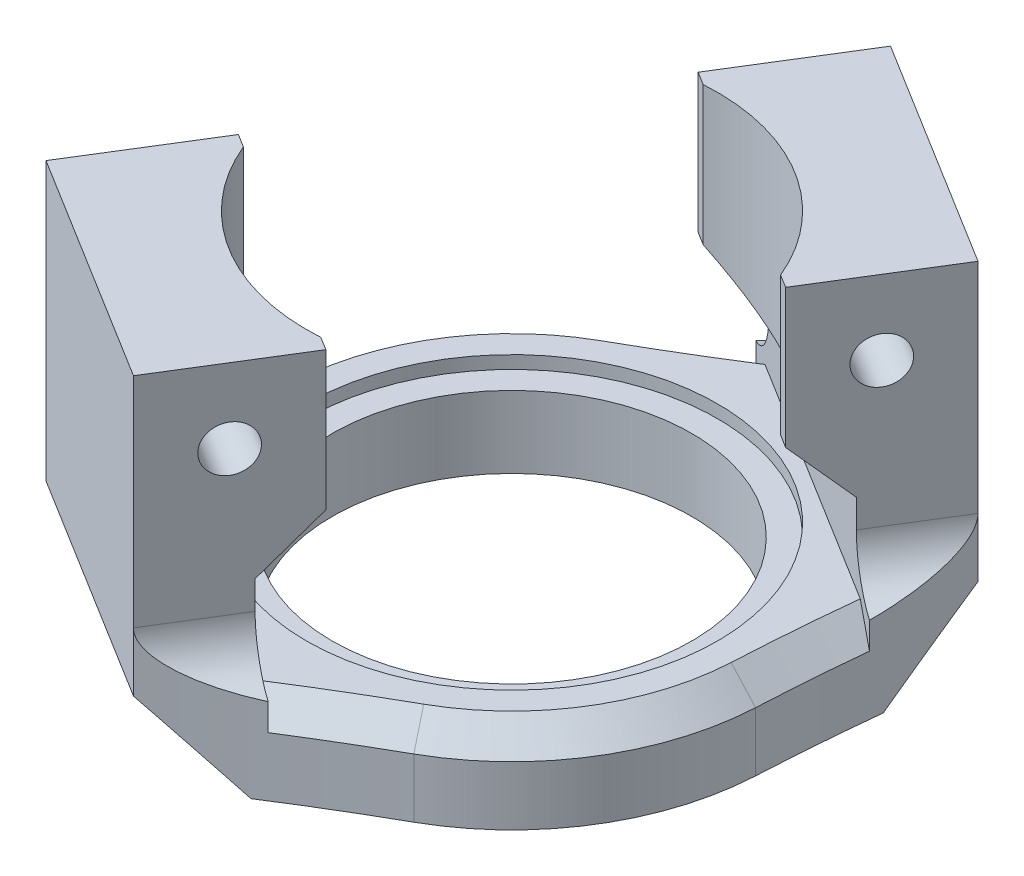
from build123d import *

# Parameters (mm, degrees)
SKETCH_1_R          = 10
SKETCH_1_R_2        = 7
EXTRUDE_1_DEPTH     = 2.8
SKETCH_2_R          = 10
SKETCH_2_R_2        = 8
EXTRUDE_2_DEPTH     = 0.5
EXTRUDE_3_DEPTH     = 8.4
EXTRUDE_4_DEPTH     = 5.4
SKETCH_7_R          = 0.9
CUT_EXTRUDE_1_DEPTH = 26.870410541
CHAMFER_2_SIZE      = 2
EXTRUDE_5_REACH     = 23.757
FILLET_2_R          = 82.5
CHAMFER_4_SIZE      = 3
FILLET_3_R          = 2
CUT_EXTRUDE_START   = -7
SKETCH_9_R          = 8
CUT_EXTRUDE_2_DEPTH = 7
CHAMFER_5_SIZE      = 1


with BuildPart() as part:
    # 草图1 → 凸台-拉伸1 (new body)
    with BuildSketch(Plane(origin=(0, 0, 0), x_dir=(1, 0, 0), z_dir=(0, 1, 0))):
        with Locations(Location((0, 0, 0), (0, 0, 270))):
            Circle(SKETCH_1_R)
        with Locations(Location((0, 0, 0), (0, 0, 270))):
            Circle(SKETCH_1_R_2, mode=Mode.SUBTRACT)
    extrude(amount=EXTRUDE_1_DEPTH)

    # 草图2 → 凸台-拉伸2 (add)
    with BuildSketch(Plane(origin=(0, 2.8, 0), x_dir=(1, 0, 0), z_dir=(0, 1, 0))):
        with Locations(Location((0, 0, 0), (0, 0, 270))):
            Circle(SKETCH_2_R)
        with Locations(Location((0, 0, 0), (0, 0, 270))):
            Circle(SKETCH_2_R_2, mode=Mode.SUBTRACT)
    extrude(amount=EXTRUDE_2_DEPTH)

    # 草图3 → 凸台-拉伸3 (add)
    with BuildSketch(Plane.XZ):
        with BuildLine():
            ThreePointArc((0, 10), (-5.267826876, 8.5), (-8.95530569, 4.45))
            Line((-8.95530569, 4.45), (0, 10))
        make_face()
        with BuildLine():
            Line((8.95530569, -4.45), (0, -10))
            ThreePointArc((0, -10), (5.267826876, -8.5), (8.95530569, -4.45))
        make_face()
    extrude(amount=-EXTRUDE_3_DEPTH)

    # 草图5 → 凸台-拉伸4 (add)
    with BuildSketch(Plane(origin=(0, 8.4, 0), x_dir=(1, 0, 0), z_dir=(0, 1, 0))):
        Polygon((1.811722614, 12.923338709), (10.767028304, 7.373338709), (7.901740315, 2.75), (-1.053565375, 8.3), align=None)
        Polygon((-7.901740315, -2.75), (1.053565375, -8.3), (-1.811722614, -12.923338709), (-10.767028304, -7.373338709), align=None)
    extrude(amount=EXTRUDE_4_DEPTH)

    # 草图7 → 切除-拉伸1 (cut, through all)
    with BuildSketch(Plane(origin=(-4.477652845, 0, -2.775), x_dir=(-0.5267826876426366, 0, 0.8500000000000003), z_dir=(-0.8500000000000003, 0, -0.5267826876426366))):
        with Locations((9.219611005, 10.9)):
            Circle(SKETCH_7_R)
        with Locations((-9.219611005, 10.9)):
            Circle(SKETCH_7_R)
    extrude(amount=-CUT_EXTRUDE_1_DEPTH, mode=Mode.SUBTRACT)

    # 倒角2
    # the kernel refuses this chamfer: 2 mm, written as the material it adds along each edge
    with BuildSketch(Plane(origin=(-8.95530569, 8.4, 4.45), x_dir=(0, -1, 0), z_dir=(0.8500000000000002, 0, 0.5267826876426367))) as chamfer_2_piece_1_section:
        Polygon((CHAMFER_2_SIZE, 0), (0, CHAMFER_2_SIZE), (0, 0), align=None)
    chamfer_2_piece_1 = extrude(amount=10.535653753, mode=Mode.PRIVATE)
    chamfer_2_piece_1 = chamfer_2_piece_1 & Plane(origin=(0, 8.4, 0), x_dir=(0, 0, 1), z_dir=(0, -1, 0)) * Cylinder(10, 30, mode=Mode.PRIVATE)
    chamfer_2_piece_1 = split(chamfer_2_piece_1, bisect_by=Plane(origin=(-7.901740315, 8.4, 2.75), z_dir=(-0.5267826876426371, 0, 0.85)), keep=Keep.TOP, mode=Mode.PRIVATE)
    add(chamfer_2_piece_1)
    with BuildSketch(Plane(origin=(8.95530569, 8.4, -4.45), x_dir=(-0.5267826876426367, 0, 0.8500000000000002), z_dir=(-0.8500000000000002, 0, -0.5267826876426367))) as chamfer_2_piece_2_section:
        Polygon((CHAMFER_2_SIZE, 0), (0, -CHAMFER_2_SIZE), (0, 0), align=None)
    chamfer_2_piece_2 = extrude(amount=10.535653753, mode=Mode.PRIVATE)
    chamfer_2_piece_2 = chamfer_2_piece_2 & Plane(origin=(0, 8.4, 0), x_dir=(0, 0, -1), z_dir=(0, -1, 0)) * Cylinder(10, 30, mode=Mode.PRIVATE)
    chamfer_2_piece_2 = split(chamfer_2_piece_2, bisect_by=Plane(origin=(7.901740315, 8.4, -2.75), z_dir=(0.5267826876426374, 0, -0.8499999999999999)), keep=Keep.TOP, mode=Mode.PRIVATE)
    add(chamfer_2_piece_2)

    # 草图8 → 凸台-拉伸5 (add, up to next)
    with BuildSketch(Plane.XZ, mode=Mode.PRIVATE) as extrude_5_sk1:
        with BuildLine():
            Line((10.767028304, -7.373338709), (8.95530569, -4.45))
            ThreePointArc((8.95530569, -4.45), (5.267826876, -8.5), (0, -10))
            Line((0, -10), (1.811722614, -12.923338709))
            Line((1.811722614, -12.923338709), (10.767028304, -7.373338709))
        make_face()
    extrude_5_tool1 = extrude(extrude_5_sk1.sketch, amount=-EXTRUDE_5_REACH, mode=Mode.PRIVATE) - part.part
    # 草图8 → 凸台-拉伸5 (add, up to next)
    with BuildSketch(Plane.XZ, mode=Mode.PRIVATE) as extrude_5_sk2:
        with BuildLine():
            Line((-10.767028304, 7.373338709), (-8.95530569, 4.45))
            ThreePointArc((-8.95530569, 4.45), (-5.267826876, 8.5), (0, 10))
            Line((0, 10), (-1.811722614, 12.923338709))
            Line((-1.811722614, 12.923338709), (-10.767028304, 7.373338709))
        make_face()
    extrude_5_tool2 = extrude(extrude_5_sk2.sketch, amount=-EXTRUDE_5_REACH, mode=Mode.PRIVATE) - part.part
    add(extrude_5_tool1.solids().sort_by_distance((5.629921, 0, -9.084263))[0])
    add(extrude_5_tool2.solids().sort_by_distance((-5.629921, 0, 9.084263))[0])

    # 圆角2
    # the kernel refuses this fillet: 82.5 mm, written as the material it adds along each edge
    with BuildSketch(Plane(origin=(0, 0, -10), x_dir=(0.526782687642631, 0, -0.8500000000000036), z_dir=(0, 1, 0))) as fillet_2_piece_1:
        with BuildLine():
            CenterArc((36.184795451, 75.723030975), FILLET_2_R, 241.113318321, 5.501155307)
            ThreePointArc((-3.669211303, 3.48794154), (-1.610231073, 1.980006188), (0, 0))
            Line((0, 0), (3.43922201, 0))
        make_face()
    extrude(amount=3.3)
    with BuildSketch(Plane(origin=(8.95530569, 0, -4.45), x_dir=(0.203827060688438, 0, 0.9790069097463571), z_dir=(0, 1, 0))) as fillet_2_piece_2:
        with BuildLine():
            CenterArc((25.945282898, 79.813276697), FILLET_2_R, 249.836350841, 5.501155307)
            Line((-2.4926907, 2.369544494), (0, 0))
            ThreePointArc((0, 0), (2.531247112, 0.325663431), (5.062494224, 0))
        make_face()
    extrude(amount=3.3)
    with BuildSketch(Plane(origin=(0, 3.3, 10), x_dir=(-0.5267826876443492, 0, 0.8499999999989388), z_dir=(0, -1, 0)), Plane(origin=(-8.95530569, 0, 4.45), x_dir=(-0.5267826876426422, 0, 0.8499999999999966), z_dir=(0, 1, 0))) as fillet_2_piece_3:
        with BuildLine():
            CenterArc((36.184795451, -75.723030975), FILLET_2_R, 113.385526372, 5.501155307)
            ThreePointArc((-3.669211303, -3.48794154), (-1.610231073, -1.980006188), (0, 0))
            Line((0, 0), (3.43922201, 0))
        make_face()
    extrude(amount=3.3)

    # 倒角4
    chamfer_4_edges = [part.edges().sort_by_distance(p)[0] for p in [
        (6.289375459, 0, -10.148338709),
        (-6.289375459, 0, 10.148338709),
    ]]
    chamfer(chamfer_4_edges, length=CHAMFER_4_SIZE)

    # 圆角3
    # the kernel refuses this fillet: 2 mm, written as the material it adds along each edge
    with BuildSketch(Plane(origin=(0, 3.3, -10), x_dir=(-0.8499999999998374, 0, -0.5267826876428993), z_dir=(0.5267826876428993, 0, -0.8499999999998374))) as fillet_3_piece_1_section:
        with BuildLine():
            CenterArc((FILLET_3_R, FILLET_3_R), FILLET_3_R, 180, 90)
            Line((0, FILLET_3_R), (0, 0))
            Line((0, 0), (FILLET_3_R, 0))
        make_face()
    fillet_3_piece_1 = extrude(amount=3.43922201, mode=Mode.PRIVATE)
    fillet_3_piece_1 = fillet_3_piece_1 - Plane(origin=(-45.303052529, 3.3, -80.646657907), x_dir=(0.5267826876428993, 0, -0.8499999999998374), z_dir=(0, -1, 0)) * Cylinder(82.5, 15, mode=Mode.PRIVATE)
    add(fillet_3_piece_1)
    with BuildSketch(Plane(origin=(-8.95530569, 3.3, 4.45), x_dir=(-0.8499999999998374, 0, -0.5267826876428994), z_dir=(-0.5267826876428993, 0, 0.8499999999998374))) as fillet_3_piece_2_section:
        with BuildLine():
            CenterArc((FILLET_3_R, -FILLET_3_R), FILLET_3_R, 90, 90)
            Line((0, -FILLET_3_R), (0, 0))
            Line((0, 0), (FILLET_3_R, 0))
        make_face()
    fillet_3_piece_2 = extrude(amount=3.43922201, mode=Mode.PRIVATE)
    fillet_3_piece_2 = fillet_3_piece_2 - Plane(origin=(-92.381405818, 3.3, -4.682505639), x_dir=(-0.5267826876428993, 0, 0.8499999999998374), z_dir=(0, -1, 0)) * Cylinder(82.5, 15, mode=Mode.PRIVATE)
    add(fillet_3_piece_2)
    with BuildSketch(Plane(origin=(10.767028304, 3.3, -7.373338709), x_dir=(0.8499999999997903, 0, 0.5267826876429756), z_dir=(-0.5267826876429755, 0, 0.8499999999997901))) as fillet_3_piece_3_section:
        with BuildLine():
            CenterArc((FILLET_3_R, FILLET_3_R), FILLET_3_R, 180, 90)
            Line((0, FILLET_3_R), (0, 0))
            Line((0, 0), (FILLET_3_R, 0))
        make_face()
    fillet_3_piece_3 = extrude(amount=3.43922201, mode=Mode.PRIVATE)
    fillet_3_piece_3 = fillet_3_piece_3 - Plane(origin=(92.381405818, 3.3, 4.68250564), x_dir=(0.20382706068808945, 0, 0.9790069097464297), z_dir=(0, -1, 0)) * Cylinder(82.5, 15, mode=Mode.PRIVATE)
    add(fillet_3_piece_3)
    with BuildSketch(Plane(origin=(0, 3.3, 10), x_dir=(0.8499999999991121, 0, 0.5267826876440694), z_dir=(-0.5267826876440695, 0, 0.8499999999991122))) as fillet_3_piece_4_section:
        with BuildLine():
            CenterArc((FILLET_3_R, FILLET_3_R), FILLET_3_R, 180, 90)
            Line((0, FILLET_3_R), (0, 0))
            Line((0, 0), (FILLET_3_R, 0))
        make_face()
    fillet_3_piece_4 = extrude(amount=3.43922201, mode=Mode.PRIVATE)
    fillet_3_piece_4 = fillet_3_piece_4 - Plane(origin=(45.303052529, 3.3, 80.646657907), x_dir=(-0.5267826876440695, 0, 0.8499999999991122), z_dir=(0, 1, 0)) * Cylinder(82.5, 15, mode=Mode.PRIVATE)
    add(fillet_3_piece_4)

    # 草图9 → 切除-拉伸2 (cut)
    with BuildSketch(Plane(origin=(0, 13.8, 0), x_dir=(1, 0, 0), z_dir=(0, 1, 0)).offset(CUT_EXTRUDE_START)):
        with Locations(Location((0, 0, 0), (0, 0, 270))):
            Circle(SKETCH_9_R)
    extrude(amount=CUT_EXTRUDE_2_DEPTH, mode=Mode.SUBTRACT)

    # 倒角5
    chamfer_5_edges = [part.edges().sort_by_distance(p)[0] for p in [
        (-8.5, 3.3, -5.267826876),
        (8.5, 3.3, 5.267826876),
        (-10.117707279, 3.3, 1.557198087),
        (10.117707279, 3.3, -1.557198087),
        (3.10786125, 3.3, 9.753669305),
        (-3.10786125, 3.3, -9.753669305),
    ]]
    chamfer(chamfer_5_edges, length=CHAMFER_5_SIZE)


solid = part.part
